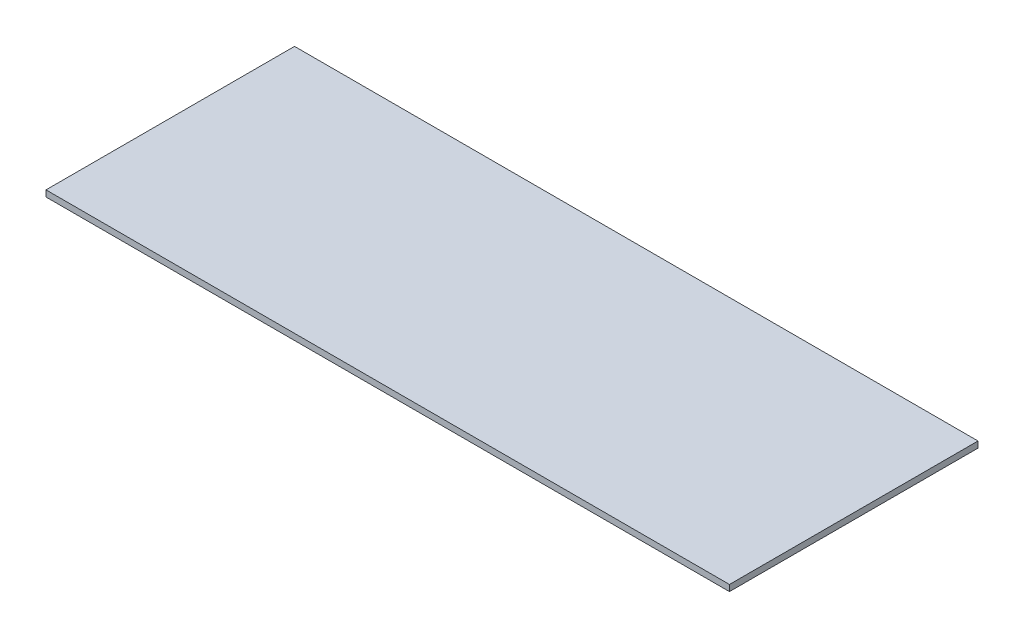
from build123d import *

# Parameters (mm, degrees)
SKETCH1_W       = 698.5
SKETCH1_H       = 254
BASEPLATE_DEPTH = 6.35


with BuildPart() as part:
    # Sketch1 → Baseplate (new body)
    with BuildSketch(Plane(origin=(0, 0, 0), x_dir=(1, 0, 0), z_dir=(0, 1, 0))):
        with Locations((-23.387860082, -2.090534979)):
            Rectangle(SKETCH1_W, SKETCH1_H)
    extrude(amount=BASEPLATE_DEPTH)


solid = part.part
